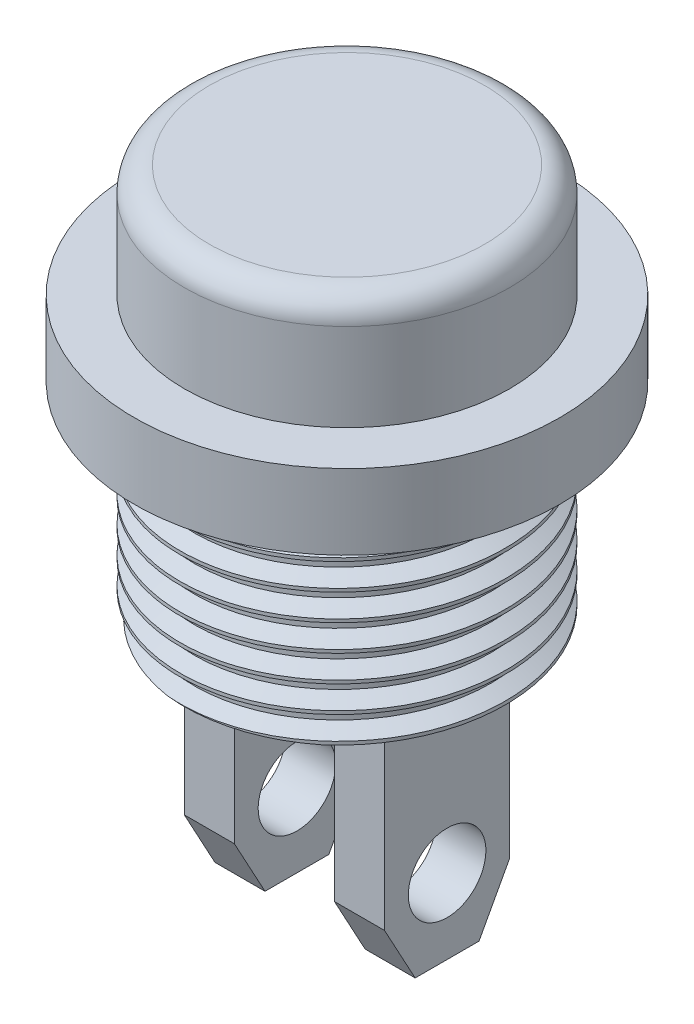
from build123d import *
from build123d.topology import SkipClean

# Parameters (mm, degrees)
ESBO_O1_W                = 6.5
ESBO_O1_H                = 8
ESBO_O2_W                = 2
ESBO_O2_H                = 5
RESSALTO_EXTRUS_O1_DEPTH = 10
ESBO_O3_R                = 1.55
CORTE_EXTRUS_O1_DEPTH    = 10
ROSCA1_PITCH             = 1.058333333


with BuildPart() as part:
    # Esboço1 → Revolução1 (revolve)
    with BuildSketch(Plane.XY, mode=Mode.PRIVATE) as revolu_o1_sk:
        with BuildLine():
            Line((12, 4.5), (6.5, 4.5))
            Line((6.5, 4.5), (6.5, 0))
            Line((6.5, 0), (13, 0))
            Line((13, 0), (13, 3.5))
            ThreePointArc((13, 3.5), (12.707106781, 4.207106781), (12, 4.5))
        make_face()
        Polygon((13, 0), (6.5, 0), (6.5, -3), (13, -3), (15, -3), (15, 0), align=None)
        with Locations((9.75, -7)):
            Rectangle(ESBO_O1_W, ESBO_O1_H)
    revolve(revolu_o1_sk.sketch.rotate(Axis((6.5, 4.5, 0), (0, -1, 0)), 180), axis=Axis((6.5, 4.5, 0), (0, -1, 0)))

    # Esboço2 → Ressalto-extrusão1 (add)
    with BuildSketch(Plane.XZ.offset(11)):
        with Locations((3.5, 0)):
            Rectangle(ESBO_O2_W, ESBO_O2_H)
        with Locations((9.5, 0)):
            Rectangle(ESBO_O2_W, ESBO_O2_H)
    extrude(amount=RESSALTO_EXTRUS_O1_DEPTH)

    # Esboço3 → Corte-extrusão1 (cut)
    with BuildSketch(Plane(origin=(10.5, 0, 0), x_dir=(0, 0, -1), z_dir=(1, 0, 0))):
        with Locations(Location((0, -18, 0), (0, 0, 90))):
            Circle(ESBO_O3_R)
        Polygon((-2.5, -18.74259258), (-1.275573847, -21), (-2.5, -21), align=None)
        Polygon((2.5, -18.74259258), (1.275573847, -21), (2.5, -21), align=None)
    extrude(amount=-CORTE_EXTRUS_O1_DEPTH, mode=Mode.SUBTRACT)

    # Rosca1: the profile of Perfil da rosca1 profile screwed along a right-hand helix of 7.559055 turns, 8 arcs to a turn; built about Z, then put on its axis
    with SkipClean():  # the faces are left unmerged after this step: merging them gives an invalid solid
        rosca1_z = Axis((0, 0, 0), (0, 0, 1))
        rosca1_corners = [(6.5003, 1e-09, -0.000173205), (6.5003, 1e-09, 0.926214869), (5.927160282, 1e-09, 0.595312499), (5.927160282, 1e-09, 0.330729165)]
        with BuildLine(mode=Mode.PRIVATE) as rosca1_profile:
            Line(rosca1_corners[0], rosca1_corners[1])
            Line(rosca1_corners[1], rosca1_corners[2])
            Line(rosca1_corners[2], rosca1_corners[3])
            Line(rosca1_corners[3], rosca1_corners[0])
        rosca1_cap = Face(rosca1_profile.wire())
        rosca1_turn_angles = [0, 22.5, 45, 67.5, 90, 112.5, 135, 157.5, 180, 202.5, 225, 247.5, 270, 292.5, 315, 337.5, 360]
        rosca1_turn_weights = [1, 0.9238795325112867, 1, 0.9238795325112867, 1, 0.9238795325112867, 1, 0.9238795325112867, 1, 0.9238795325112867, 1, 0.9238795325112867, 1, 0.9238795325112867, 1, 0.9238795325112867, 1]
        rosca1_turn_rails = [Edge.make_bspline([Vector(p[0], p[1], 0).rotate(rosca1_z, rosca1_turn_angles[k]) / rosca1_turn_weights[k] + Vector(0, 0, p[2] + ROSCA1_PITCH * rosca1_turn_angles[k] / 360) for k in range(17)], [0, 0, 0, 1, 1, 2, 2, 3, 3, 4, 4, 5, 5, 6, 6, 7, 7, 8, 8, 8], 2, rosca1_turn_weights) for p in rosca1_corners]
        rosca1_turn_sides = [Face.make_surface_from_curves(rosca1_turn_rails[p[0]], rosca1_turn_rails[p[1]]) for p in [(0, 1), (1, 2), (2, 3), (3, 0)]]
        rosca1_last_angles = [2520, 2542.5, 2565, 2587.5, 2610, 2632.5, 2655, 2677.5, 2700, 2710.62992126, 2721.25984252]
        rosca1_last_weights = [1, 0.9238795325112867, 1, 0.9238795325112867, 1, 0.9238795325112867, 1, 0.9238795325112867, 1, 0.9828391512194228, 1]
        rosca1_last_rails = [Edge.make_bspline([Vector(p[0], p[1], 0).rotate(rosca1_z, rosca1_last_angles[k]) / rosca1_last_weights[k] + Vector(0, 0, p[2] + ROSCA1_PITCH * rosca1_last_angles[k] / 360) for k in range(11)], [0, 0, 0, 1, 1, 2, 2, 3, 3, 4, 4, 5, 5, 5], 2, rosca1_last_weights) for p in rosca1_corners]
        rosca1_last_sides = [Face.make_surface_from_curves(rosca1_last_rails[p[0]], rosca1_last_rails[p[1]]) for p in [(0, 1), (1, 2), (2, 3), (3, 0)]]
        rosca1 = Plane(origin=(6.5, -3, 0), x_dir=(-0.866025404, 0, -0.5), z_dir=(0, -1, 0)) * Solid(Shell([*[p.moved(Location((0, 0, ROSCA1_PITCH * i))) for i in range(7) for p in rosca1_turn_sides], *rosca1_last_sides, rosca1_cap, rosca1_cap.rotate(rosca1_z, 2721.25984252).moved(Location((0, 0, ROSCA1_PITCH * 2721.25984252 / 360)))]))
        add(rosca1, mode=Mode.SUBTRACT)


solid = part.part
